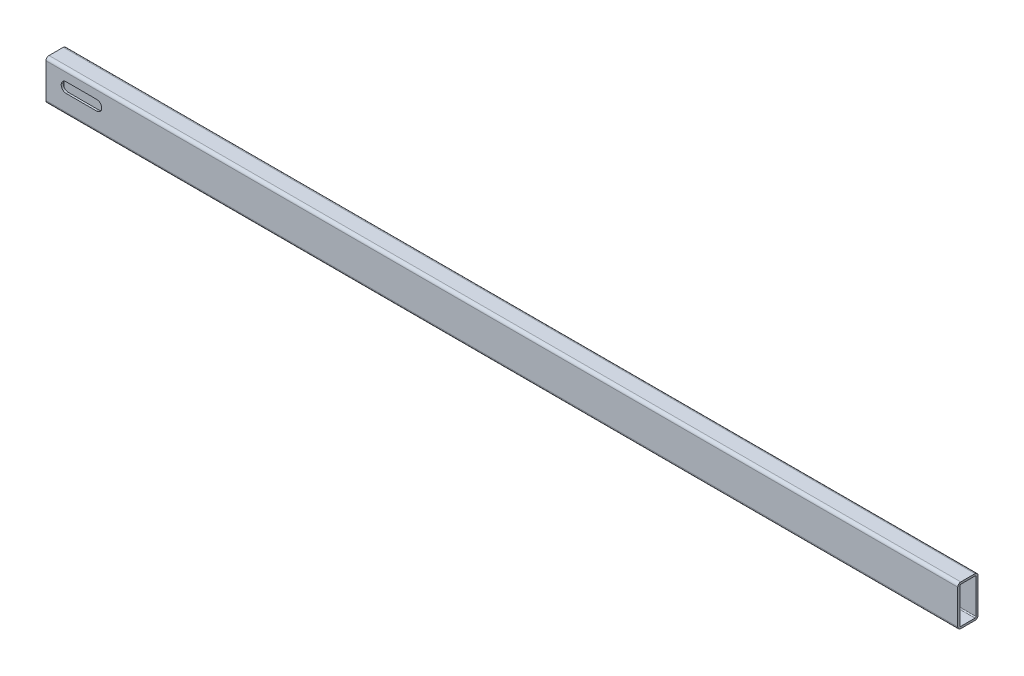
from build123d import *

# Parameters (mm, degrees)
EXTRUDE_1_DEPTH     = 900
CUT_EXTRUDE_1_DEPTH = 40


with BuildPart() as part:
    # Эскиз1 → Вытянуть-Тонкостенный1 (new body)
    with BuildSketch(Plane(origin=(0, 0, 0), x_dir=(0, 0, -1), z_dir=(1, 0, 0))):
        with BuildLine():
            Line((-2, 35), (-2, 1))
            ThreePointArc((-2, 1), (-1.121320344, -1.121320344), (1, -2))
            Line((1, -2), (15, -2))
            ThreePointArc((15, -2), (17.121320344, -1.121320344), (18, 1))
            Line((18, 1), (18, 35))
            ThreePointArc((18, 35), (17.121320344, 37.121320344), (15, 38))
            Line((15, 38), (1, 38))
            ThreePointArc((1, 38), (-1.121320344, 37.121320344), (-2, 35))
        make_face()
        with BuildLine():
            Line((0, 35), (0, 1))
            ThreePointArc((0, 1), (0.292893219, 0.292893219), (1, 0))
            Line((1, 0), (15, 0))
            ThreePointArc((15, 0), (15.707106781, 0.292893219), (16, 1))
            Line((16, 1), (16, 35))
            ThreePointArc((16, 35), (15.707106781, 35.707106781), (15, 36))
            Line((15, 36), (1, 36))
            ThreePointArc((1, 36), (0.292893219, 35.707106781), (0, 35))
        make_face(mode=Mode.SUBTRACT)
    extrude(amount=EXTRUDE_1_DEPTH)

    # Эскиз2 → Вырез-Вытянуть1 (cut)
    with BuildSketch(Plane.XY.offset(2)):
        with BuildLine():
            Line((20, 27), (50, 27))
            ThreePointArc((50, 27), (55, 22), (50, 17))
            Line((50, 17), (20, 17))
            ThreePointArc((20, 17), (15, 22), (20, 27))
        make_face()
    extrude(amount=-CUT_EXTRUDE_1_DEPTH, mode=Mode.SUBTRACT)


solid = part.part
